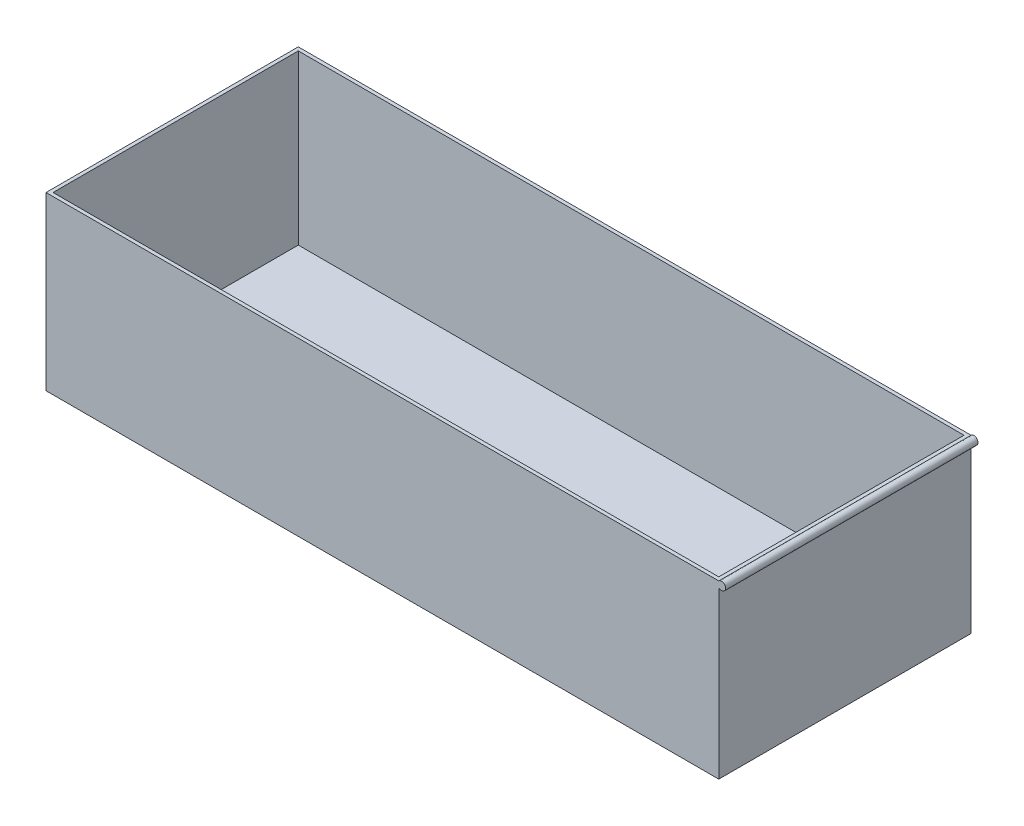
from build123d import *

# Parameters (mm, degrees)
SKETCH1_W           = 304.8
SKETCH1_H           = 114.3
BOSS_EXTRUDE1_DEPTH = 1.5875
SKETCH2_W           = 304.8
SKETCH2_H           = 114.3
SKETCH2_W_2         = 301.625
SKETCH2_H_2         = 111.125
BOSS_EXTRUDE2_DEPTH = 76.2
BOSS_EXTRUDE3_DEPTH = 57.15


with BuildPart() as part:
    # Sketch1 → Boss-Extrude1 (new body)
    with BuildSketch(Plane(origin=(0, 0, 0), x_dir=(1, 0, 0), z_dir=(0, 1, 0))):
        Rectangle(SKETCH1_W, SKETCH1_H)
    extrude(amount=BOSS_EXTRUDE1_DEPTH)

    # Sketch2 → Boss-Extrude2 (add)
    with BuildSketch(Plane(origin=(0, 1.5875, 0), x_dir=(1, 0, 0), z_dir=(0, 1, 0))):
        Rectangle(SKETCH2_W, SKETCH2_H)
        Rectangle(SKETCH2_W_2, SKETCH2_H_2, mode=Mode.SUBTRACT)
    extrude(amount=BOSS_EXTRUDE2_DEPTH)

    # Sketch3 → Boss-Extrude3 (add, symmetric)
    with BuildSketch(Plane.XY):
        with BuildLine():
            ThreePointArc((152.4, 75.18002351), (155.547502553, 76.483761755), (152.4, 77.7875))
            Line((152.4, 77.7875), (152.4, 75.18002351))
        make_face()
    extrude(amount=BOSS_EXTRUDE3_DEPTH, both=True)


solid = part.part
